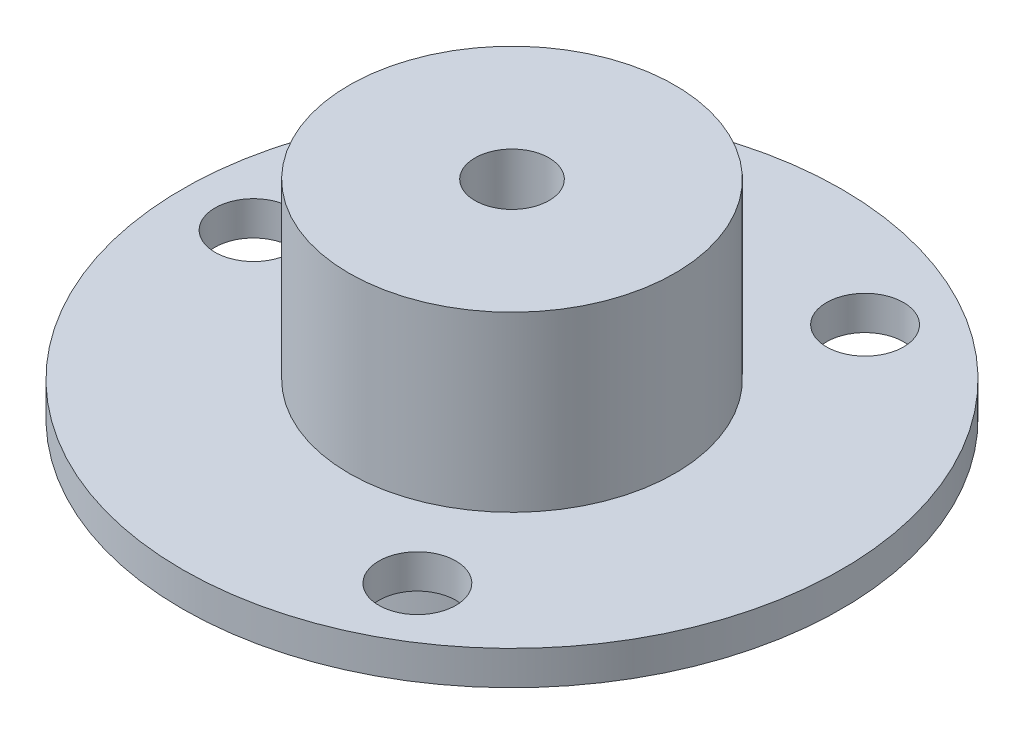
from build123d import *

# Parameters (mm, degrees)
SKETCH1_R             = 11
BOSS_EXTRUDE1_DEPTH   = 19
SKETCH2_R             = 22.25
BOSS_EXTRUDE2_DEPTH   = 2.3
SKETCH4_R             = 2.5
CUT_EXTRUDE1_DEPTH    = 37.757652265
SKETCH5_R             = 2.6
CUT_EXTRUDE2_DEPTH    = 35.440165505
BOSS_EXTRUDE3_START   = 5
SKETCH6_R             = 4.5
SKETCH6_R_2           = 2.5
BOSS_EXTRUDE3_DEPTH   = 5
SKETCH7_R             = 0.5
BOSS_EXTRUDE4_DEPTH   = 3
BOSS_EXTRUDE4_2_DEPTH = 3
BOSS_EXTRUDE4_3_DEPTH = 3
BOSS_EXTRUDE4_4_DEPTH = 3
BOSS_EXTRUDE4_5_DEPTH = 3
BOSS_EXTRUDE4_6_DEPTH = 3


with BuildPart() as part:
    # Sketch1 → Boss-Extrude1 (new body)
    with BuildSketch(Plane(origin=(0, 0, 0), x_dir=(1, 0, 0), z_dir=(0, 1, 0))):
        Circle(SKETCH1_R)
    extrude(amount=BOSS_EXTRUDE1_DEPTH)

    # Sketch2 → Boss-Extrude2 (add)
    with BuildSketch(Plane(origin=(0, 5, 0), x_dir=(1, 0, 0), z_dir=(0, 1, 0))):
        Circle(SKETCH2_R)
    extrude(amount=BOSS_EXTRUDE2_DEPTH)

    # Sketch4 → Cut-Extrude1 (cut, through all)
    with BuildSketch(Plane.XZ):
        Circle(SKETCH4_R)
    extrude(amount=-CUT_EXTRUDE1_DEPTH, mode=Mode.SUBTRACT)

    # Sketch5 → Cut-Extrude2 (cut, through all)
    with BuildSketch(Plane.XZ.offset(-5)):
        with Locations((-17.45, 0)):
            Circle(SKETCH5_R)
        with Locations((8.725, 15.112143296)):
            Circle(SKETCH5_R)
        with Locations((8.725, -15.112143296)):
            Circle(SKETCH5_R)
    extrude(amount=-CUT_EXTRUDE2_DEPTH, mode=Mode.SUBTRACT)

    # Sketch6 → Boss-Extrude3 (add)
    with BuildSketch(Plane.XZ.offset(BOSS_EXTRUDE3_START)):
        Circle(SKETCH6_R)
        Circle(SKETCH6_R_2, mode=Mode.SUBTRACT)
    extrude(amount=-BOSS_EXTRUDE3_DEPTH)


with BuildPart() as body_2:
    # Sketch7 → Boss-Extrude4 (new body)
    with BuildSketch(Plane.XZ.offset(5)):
        with Locations((3.103518322, 1.618077263)):
            Circle(SKETCH7_R)
    extrude(amount=BOSS_EXTRUDE4_DEPTH)


with BuildPart() as body_3:
    # Sketch7 → Boss-Extrude4 2 (new body)
    with BuildSketch(Plane.XZ.offset(5)):
        with Locations((3.5, 0)):
            Circle(SKETCH7_R)
    extrude(amount=BOSS_EXTRUDE4_2_DEPTH)


with BuildPart() as body_4:
    # Sketch7 → Boss-Extrude4 3 (new body)
    with BuildSketch(Plane.XZ.offset(5)):
        with Locations((3.089895924, -1.643941355)):
            Circle(SKETCH7_R)
    extrude(amount=BOSS_EXTRUDE4_3_DEPTH)


with BuildPart() as body_5:
    # Sketch7 → Boss-Extrude4 4 (new body)
    with BuildSketch(Plane.XZ.offset(5)):
        with Locations((-3.089895924, -1.643941355)):
            Circle(SKETCH7_R)
    extrude(amount=BOSS_EXTRUDE4_4_DEPTH)


with BuildPart() as body_6:
    # Sketch7 → Boss-Extrude4 5 (new body)
    with BuildSketch(Plane.XZ.offset(5)):
        with Locations((-3.5, 0)):
            Circle(SKETCH7_R)
    extrude(amount=BOSS_EXTRUDE4_5_DEPTH)


with BuildPart() as body_7:
    # Sketch7 → Boss-Extrude4 6 (new body)
    with BuildSketch(Plane.XZ.offset(5)):
        with Locations((-3.103518322, 1.618077263)):
            Circle(SKETCH7_R)
    extrude(amount=BOSS_EXTRUDE4_6_DEPTH)


solid = Compound([part.part, body_2.part, body_3.part, body_4.part, body_5.part, body_6.part, body_7.part])
